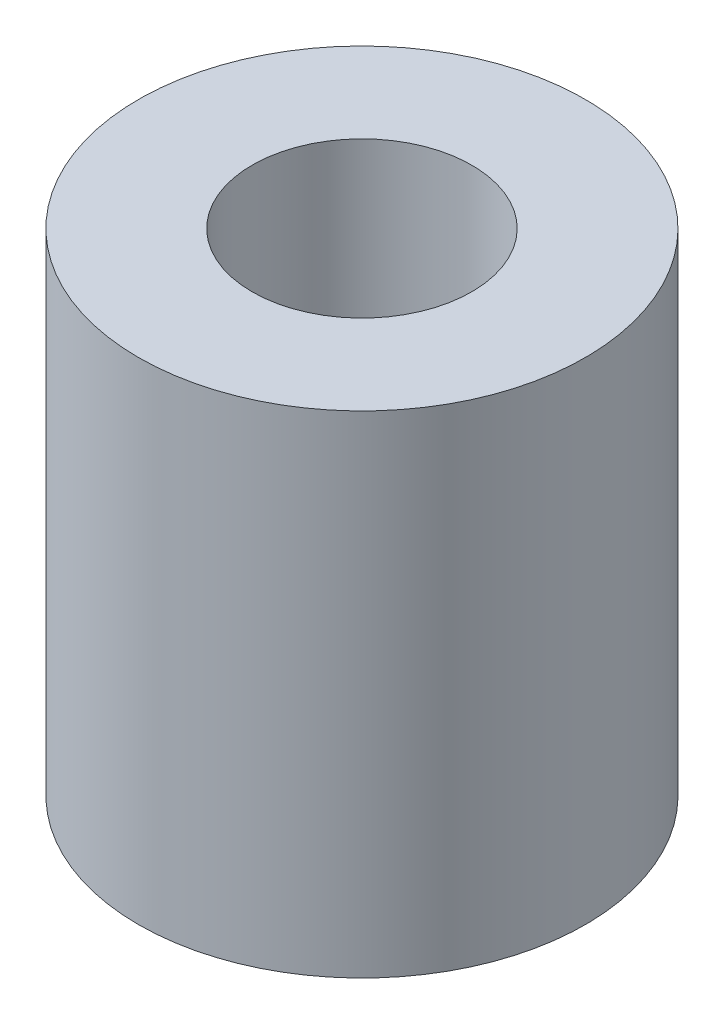
from build123d import *

# Parameters (mm, degrees)
SKETCH1_R           = 10
BOSS_EXTRUDE1_DEPTH = 21.976
SKETCH2_R           = 4.9125
CUT_EXTRUDE1_DEPTH  = 27.133208299


with BuildPart() as part:
    # Sketch1 → Boss-Extrude1 (new body)
    with BuildSketch(Plane(origin=(0, 0, 0), x_dir=(1, 0, 0), z_dir=(0, 1, 0))):
        Circle(SKETCH1_R)
    extrude(amount=BOSS_EXTRUDE1_DEPTH)

    # Sketch2 → Cut-Extrude1 (cut, through all)
    with BuildSketch(Plane(origin=(0, 21.976, 0), x_dir=(1, 0, 0), z_dir=(0, 1, 0))):
        Circle(SKETCH2_R)
    extrude(amount=-CUT_EXTRUDE1_DEPTH, mode=Mode.SUBTRACT)


solid = part.part
